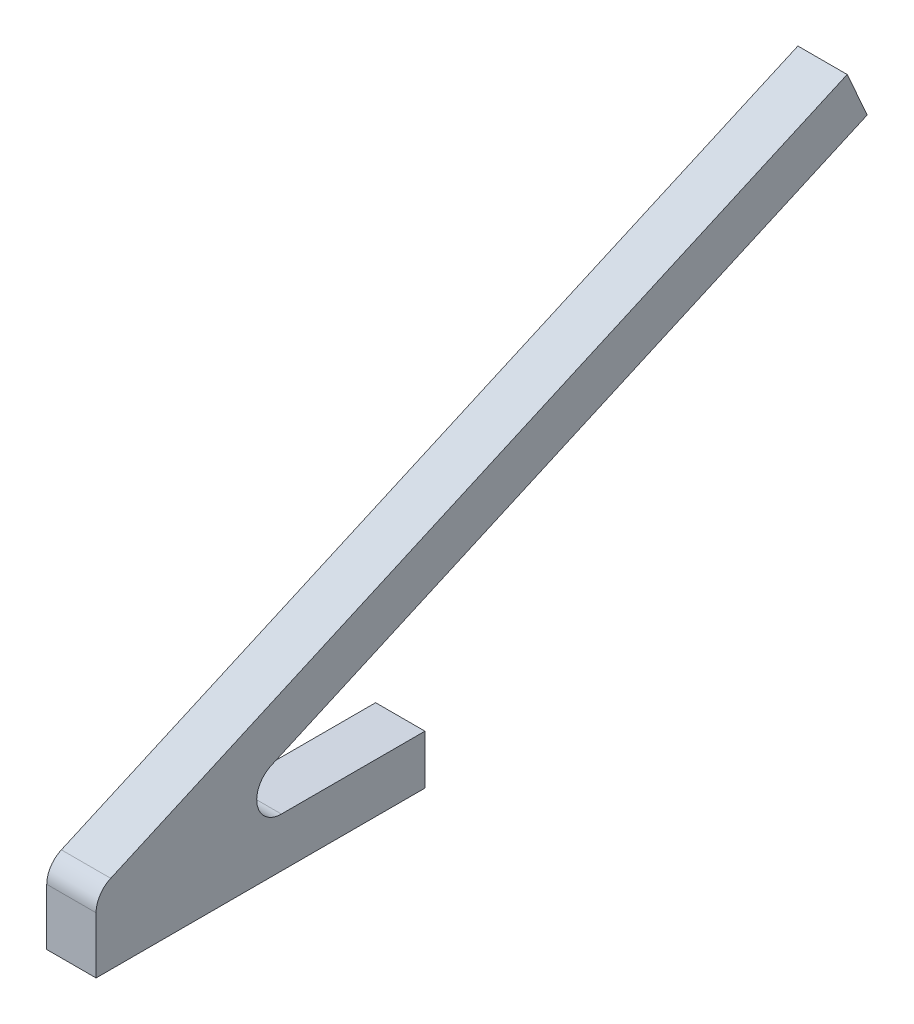
from build123d import *

# Parameters (mm, degrees)
BOSS_EXTRUDE1_DEPTH = 6
FILLET1_R           = 3


with BuildPart() as part:
    # Sketch1 → Boss-Extrude1 (new body)
    with BuildSketch(Plane(origin=(0, 0, 0), x_dir=(0, 0, -1), z_dir=(1, 0, 0))):
        Polygon((0, 0), (0, 8.817336182), (91.354545764, 49.49100049), (93.794965623, 44.009727744), (8.423719343, 6), (40, 6), (40, 0), align=None)
    extrude(amount=BOSS_EXTRUDE1_DEPTH)

    # Fillet1
    fillet1_edges = [part.edges().sort_by_distance(p)[0] for p in [
        (3, 8.817336182, 0),
        (3, 6, -8.423719343),
    ]]
    fillet(fillet1_edges, radius=FILLET1_R)


solid = part.part
